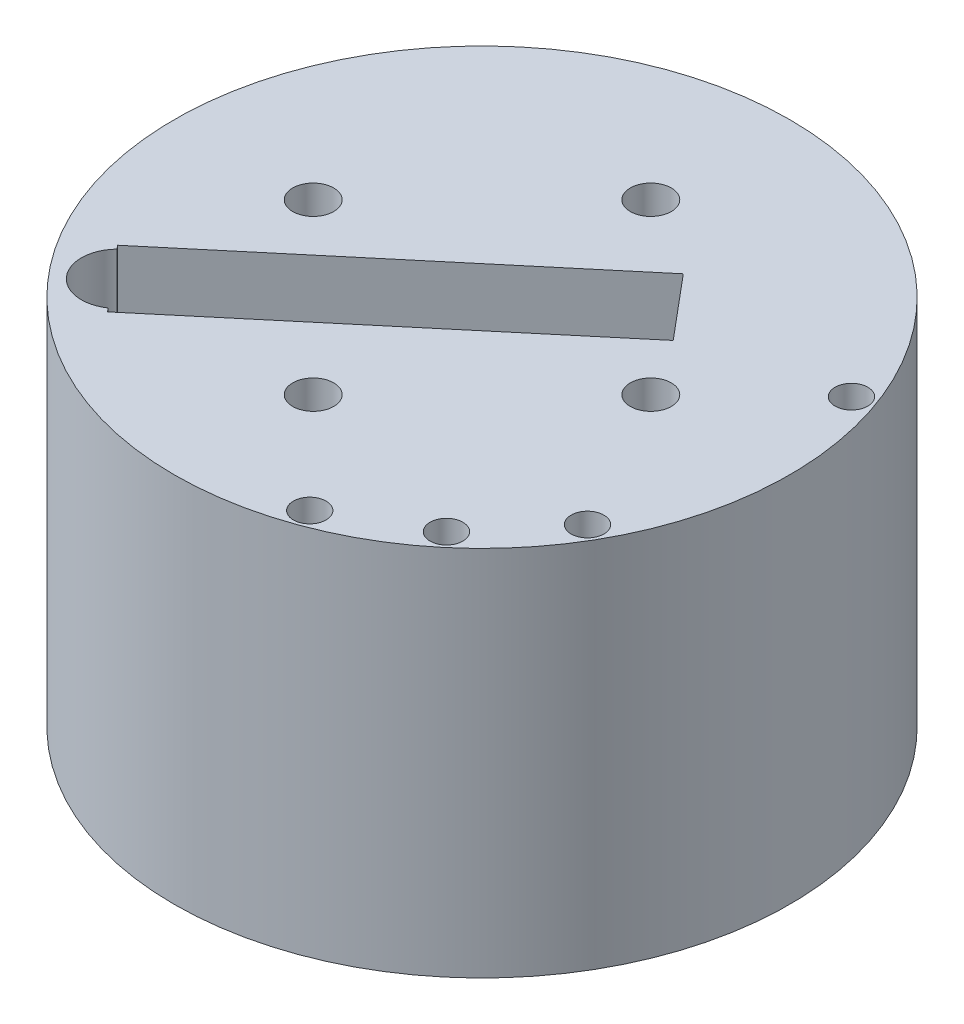
from build123d import *

# Parameters (mm, degrees)
SKETCH2_R           = 47.6885
BOSS_EXTRUDE1_DEPTH = 57.658
SKETCH5_R           = 5.6388
CUT_EXTRUDE2_DEPTH  = 89.728975135
SKETCH4_R           = 3.175
CUT_EXTRUDE3_DEPTH  = 89.728975135
CUT_EXTRUDE4_DEPTH  = 43.18
SKETCH11_R          = 6.35
CUT_EXTRUDE7_DEPTH  = 7.62
SKETCH14_R          = 2.067000057
CUT_EXTRUDE8_DEPTH  = 19.05
SKETCH15_R          = 2.54
CUT_EXTRUDE10_DEPTH = 84.074


with BuildPart() as part:
    # Sketch2 → Boss-Extrude1 (new body)
    with BuildSketch(Plane(origin=(0, 0, 0), x_dir=(1, 0, 0), z_dir=(0, 1, 0))):
        Circle(SKETCH2_R)
    extrude(amount=BOSS_EXTRUDE1_DEPTH)

    # Sketch5 → Cut-Extrude2 (cut, through all)
    with BuildSketch(Plane(origin=(0, 57.658, 0), x_dir=(1, 0, 0), z_dir=(0, 1, 0))):
        with Locations((-30.694251769, -25.755535339)):
            Circle(SKETCH5_R)
    extrude(amount=-CUT_EXTRUDE2_DEPTH, mode=Mode.SUBTRACT)

    # Sketch4 → Cut-Extrude3 (cut, through all)
    with BuildSketch(Plane(origin=(0, 57.658, 0), x_dir=(1, 0, 0), z_dir=(0, 1, 0))):
        with Locations((-26.162, 0)):
            Circle(SKETCH4_R)
        with Locations((26.162, 0)):
            Circle(SKETCH4_R)
        with Locations((0, 26.162)):
            Circle(SKETCH4_R)
        with Locations((0, -26.162)):
            Circle(SKETCH4_R)
    extrude(amount=-CUT_EXTRUDE3_DEPTH, mode=Mode.SUBTRACT)

    # Sketch6 → Cut-Extrude4 (cut)
    with BuildSketch(Plane(origin=(0, 57.658, 0), x_dir=(1, 0, 0), z_dir=(0, 1, 0))):
        Polygon((-27.050344847, -30.987270671), (20.620600848, 9.013402279), (12.457198205, 18.742166707), (-35.21374749, -21.258506244), align=None)
    extrude(amount=-CUT_EXTRUDE4_DEPTH, mode=Mode.SUBTRACT)

    # Sketch11 → Cut-Extrude7 (cut)
    with BuildSketch(Plane.XZ):
        with Locations((0, 26.162)):
            Circle(SKETCH11_R)
        with Locations((26.162, 0)):
            Circle(SKETCH11_R)
        with Locations((0, -26.162)):
            Circle(SKETCH11_R)
        with Locations((-26.162, 0)):
            Circle(SKETCH11_R)
    extrude(amount=-CUT_EXTRUDE7_DEPTH, mode=Mode.SUBTRACT)

    # Sketch14 → Cut-Extrude8 (cut)
    with BuildSketch(Plane.XZ):
        with Locations((1.356935186, -14.949033782)):
            Circle(SKETCH14_R)
        with Locations((4.523691953, 8.972265338)):
            Circle(SKETCH14_R)
    extrude(amount=-CUT_EXTRUDE8_DEPTH, mode=Mode.SUBTRACT)

    # Sketch15 → Cut-Extrude10 (cut)
    with BuildSketch(Plane.XZ):
        with Locations((28.715637383, 34.221964015)):
            Circle(SKETCH15_R)
        with Locations((38.688469188, 22.3367981)):
            Circle(SKETCH15_R)
        with Locations((15.279269775, 41.979448693)):
            Circle(SKETCH15_R)
        with Locations((41.979448693, -15.279269775)):
            Circle(SKETCH15_R)
    extrude(amount=-CUT_EXTRUDE10_DEPTH, mode=Mode.SUBTRACT)


solid = part.part
